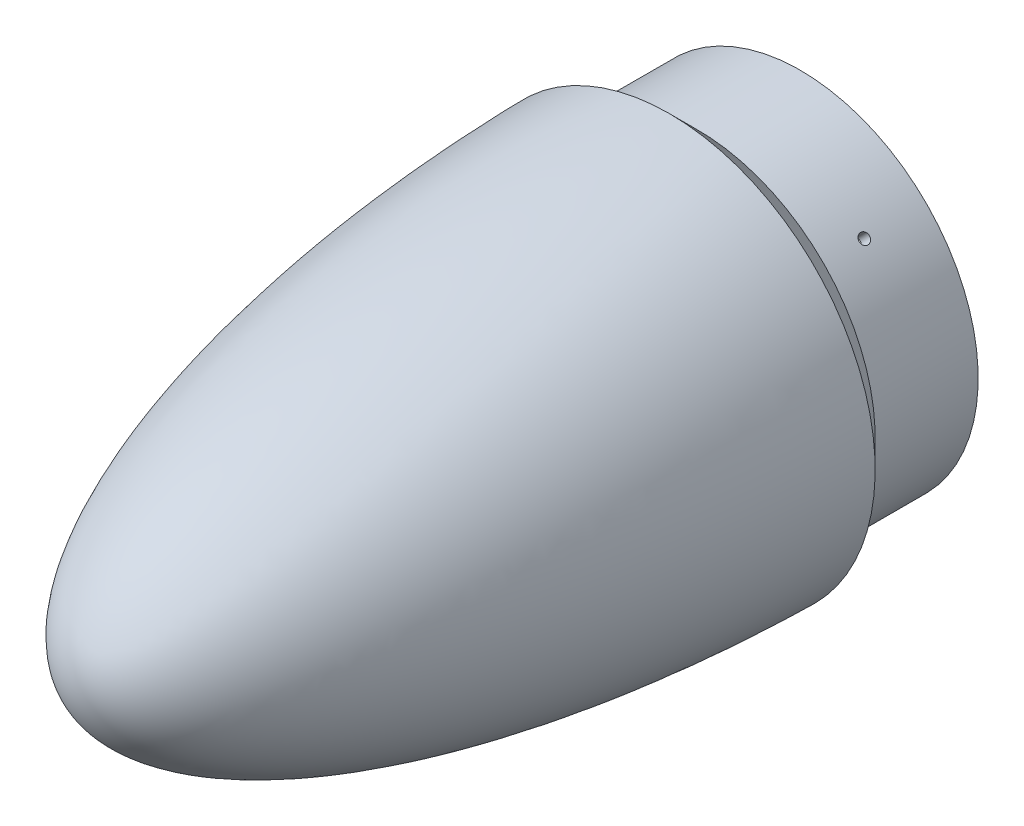
from build123d import *

# Parameters (mm, degrees)
UPPER_AIRFRAME_COUPLER_SKETCH_R      = 43.15
UPPER_AIRFRAME_COUPLER_SKETCH_R_2    = 39.975
UPPER_AIRFRAME_COUPLER_EXTRUDE_DEPTH = 25
SHEAR_PIN_BORE_CUT_REACH             = 190.276
SHEAR_PIN_BORE_CUT_END_RADIUS        = 39.975
SHEAR_PIN_BORE_SKETCH_R              = 1.25
SHEAR_PIN_PATTERN_COUNT              = 4
CUT_EXTRUDE2_DEPTH                   = 40
CUT_EXTRUDE2_DEPTH_BACK              = 144.578301529
SKETCH1_R                            = 3


with BuildPart() as part:
    # Ellipsoid Sketch → Ellipsoid Revolve (revolve)
    with BuildSketch(Plane(origin=(0, 0, 0), x_dir=(0, 0, -1), z_dir=(1, 0, 0))):
        with BuildLine():
            Line((-150, 0), (-100, 0))
            add(Edge.make_bspline(
                [(0, 39.975), (-100, 39.975), (-100, 0)],
                knots=[4.71238898, 4.71238898, 4.71238898, 6.283185307, 6.283185307, 6.283185307], degree=2, weights=[1, 0.707106781, 1]))
            Line((0, 39.975), (0, 50))
            add(Edge.make_bspline(
                [(0, 50), (-150, 50), (-150, 0)],
                knots=[4.71238898, 4.71238898, 4.71238898, 6.283185307, 6.283185307, 6.283185307], degree=2, weights=[1, 0.707106781, 1]))
        make_face()
    revolve(axis=Axis((0, 0, -7.5), (0, 0, 1)))

    # Upper Airframe Coupler Sketch → Upper Airframe Coupler Extrude (add)
    with BuildSketch(Plane(origin=(0, 0, 0), x_dir=(-1, 0, 0), z_dir=(0, 0, -1))):
        Circle(UPPER_AIRFRAME_COUPLER_SKETCH_R)
        Circle(UPPER_AIRFRAME_COUPLER_SKETCH_R_2, mode=Mode.SUBTRACT)
    extrude(amount=UPPER_AIRFRAME_COUPLER_EXTRUDE_DEPTH)

    # Upper Airframe Mate Chamfer: read off the stored shape, not the designer's step
    # Upper Airframe Mate Chamfer outline → Upper Airframe Mate Chamfer (revolve, cut)
    with BuildSketch(Plane.XZ):
        Polygon((49.948616721, 6.798616721), (43.15, 0), (50, 0), (50, 6.798616721), align=None)
    revolve(axis=Axis((0, 0, 0), (0, 0, 1)), mode=Mode.SUBTRACT)

    # Shear Pin Bore Cut: up to this cylinder (the profile starts outside it)
    shear_pin_bore_cut_end = Plane(origin=(0, 0, -10), z_dir=(0, 0, -1)) * Cylinder(SHEAR_PIN_BORE_CUT_END_RADIUS, 461.502, mode=Mode.PRIVATE)
    # Shear Pin Bore Sketch → Shear Pin Bore Cut (cut, up to the surface)
    with BuildSketch(Plane(origin=(30.511657608, -30.511657608, 0), x_dir=(-0.7071067811865475, -0.7071067811865477, 0), z_dir=(0.7071067811865477, -0.7071067811865475, 0)), mode=Mode.PRIVATE) as shear_pin_bore_cut_sk1:
        with Locations(Location((0, 10, 0), (0, 0, 180))):
            Circle(SHEAR_PIN_BORE_SKETCH_R)
    shear_pin_bore_cut_tool1 = extrude(shear_pin_bore_cut_sk1.sketch, amount=-SHEAR_PIN_BORE_CUT_REACH, mode=Mode.PRIVATE) - shear_pin_bore_cut_end
    shear_pin_bore_cut = shear_pin_bore_cut_tool1.solids().sort_by_distance((30.511658, -30.511658, -10))[0]
    add(shear_pin_bore_cut, mode=Mode.SUBTRACT)

    # Shear Pin Pattern: Shear Pin Bore Cut ×4 about axis
    shear_pin_pattern_axis = Axis((0, 0, 0), (0, 0, 1))
    for i in range(1, SHEAR_PIN_PATTERN_COUNT):
        add(shear_pin_bore_cut.rotate(shear_pin_pattern_axis, i * 360 / SHEAR_PIN_PATTERN_COUNT), mode=Mode.SUBTRACT)

    # Sketch1 → Cut-Extrude2 (cut, two sides: drawn at the far end of the back side and taken through both)
    with BuildSketch(Plane.XY.offset(100).offset(-CUT_EXTRUDE2_DEPTH_BACK)):
        Circle(SKETCH1_R)
    extrude(amount=CUT_EXTRUDE2_DEPTH + CUT_EXTRUDE2_DEPTH_BACK, mode=Mode.SUBTRACT)


solid = part.part
